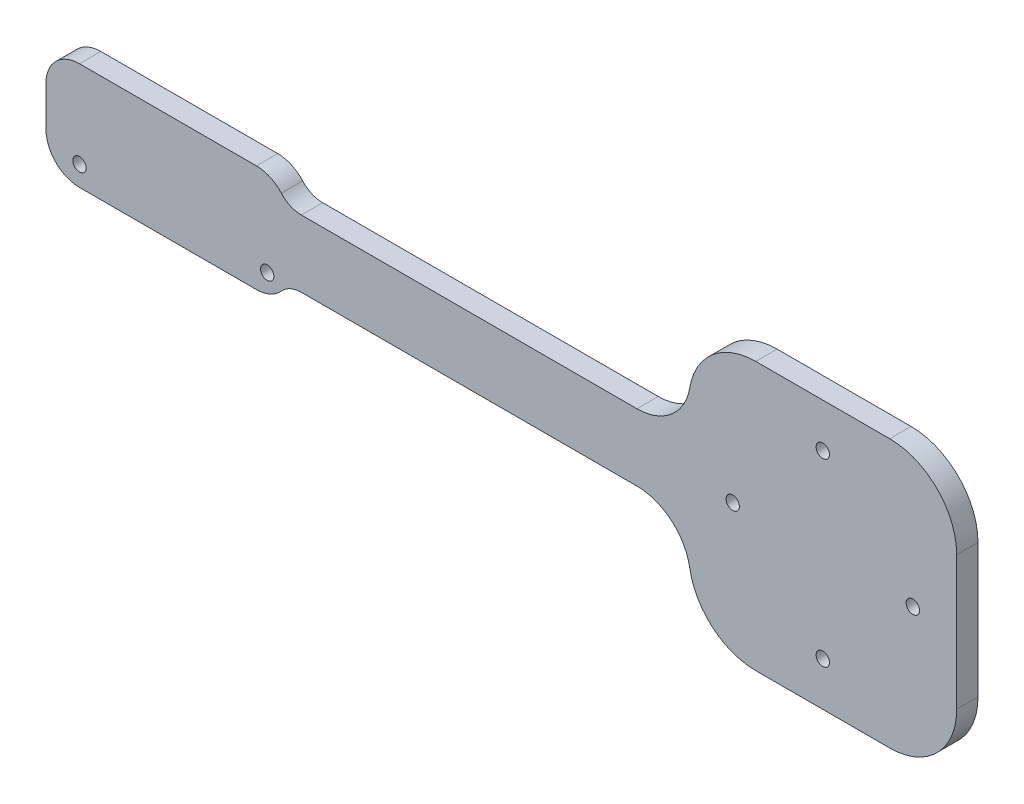
from build123d import *

# Parameters (mm, degrees)
SKETCH1_W           = 40
SKETCH1_H           = 40
BOSS_EXTRUDE1_DEPTH = 3.18
SKETCH2_W           = 3.18
SKETCH2_H           = 10
BOSS_EXTRUDE2_DEPTH = 60
SKETCH3_W           = 3.18
SKETCH3_H           = 16
BOSS_EXTRUDE3_DEPTH = 36
FILLET1_R           = 10
FILLET2_R           = 8
FILLET3_R           = 5
FILLET4_R           = 4
SKETCH7_R           = 1
CUT_EXTRUDE2_DEPTH  = 3.18
SKETCH8_R           = 1
CUT_EXTRUDE3_DEPTH  = 3.18


with BuildPart() as part:
    # Sketch1 → Boss-Extrude1 (new body)
    with BuildSketch(Plane.XY):
        with Locations((50, 0)):
            Rectangle(SKETCH1_W, SKETCH1_H)
    extrude(amount=BOSS_EXTRUDE1_DEPTH)

    # Sketch2 → Boss-Extrude2 (add)
    with BuildSketch(Plane.ZY.offset(-30)):
        with Locations((1.59, 0)):
            Rectangle(SKETCH2_W, SKETCH2_H)
    extrude(amount=BOSS_EXTRUDE2_DEPTH)

    # Sketch3 → Boss-Extrude3 (add)
    with BuildSketch(Plane.ZY.offset(30)):
        with Locations((1.59, 0)):
            Rectangle(SKETCH3_W, SKETCH3_H)
    extrude(amount=BOSS_EXTRUDE3_DEPTH)

    # Fillet1
    fillet1_edges = [part.edges().sort_by_distance(p)[0] for p in [
        (70, -20, 1.59),
        (30, -20, 1.59),
        (30, 20, 1.59),
        (70, 20, 1.59),
    ]]
    fillet(fillet1_edges, radius=FILLET1_R)

    # Fillet2
    fillet2_edges = [part.edges().sort_by_distance(p)[0] for p in [
        (30, 5, 1.59),
        (30, -5, 1.59),
    ]]
    fillet(fillet2_edges, radius=FILLET2_R)

    # Fillet3
    # the kernel refuses this fillet: 5 mm, written as the material it takes off along each edge
    with BuildSketch(Plane(origin=(-30, 8, -11.456439237), x_dir=(-1, 0, 0), z_dir=(0, 0, 1))) as fillet3_piece_1:
        with BuildLine():
            CenterArc((4.582575695, 5), FILLET3_R, 203.578178478, 66.421821522)
            Line((0, 3), (-0.091651514, 2.96))
            ThreePointArc((-0.091651514, 2.96), (-0.1, 1.5), (-0.1, 0))
            Line((-0.1, 0), (0, -0.1))
            Line((0, -0.1), (4.582575695, -0.1))
            Line((4.582575695, -0.1), (4.582575695, 0))
        make_face()
    extrude(amount=26.092878475, mode=Mode.SUBTRACT)
    with BuildSketch(Plane(origin=(-66, 8, -12.5), x_dir=(0, -1, 0), z_dir=(0, 0, 1))) as fillet3_piece_2:
        with BuildLine():
            CenterArc((FILLET3_R, FILLET3_R), FILLET3_R, 180, 90)
            Line((0, FILLET3_R), (-FILLET3_R * 0.02, FILLET3_R))
            Line((-FILLET3_R * 0.02, FILLET3_R), (-FILLET3_R * 0.02, -FILLET3_R * 0.02))
            Line((-FILLET3_R * 0.02, -FILLET3_R * 0.02), (FILLET3_R, -FILLET3_R * 0.02))
            Line((FILLET3_R, -FILLET3_R * 0.02), (FILLET3_R, 0))
        make_face()
    extrude(amount=28.18, mode=Mode.SUBTRACT)
    with BuildSketch(Plane(origin=(-66, -8, 15.68), x_dir=(1, 0, 0), z_dir=(0, 0, -1))) as fillet3_piece_3:
        with BuildLine():
            CenterArc((FILLET3_R, -FILLET3_R), FILLET3_R, 90, 90)
            Line((0, -FILLET3_R), (-FILLET3_R * 0.02, -FILLET3_R))
            Line((-FILLET3_R * 0.02, -FILLET3_R), (-FILLET3_R * 0.02, FILLET3_R * 0.02))
            Line((-FILLET3_R * 0.02, FILLET3_R * 0.02), (FILLET3_R, FILLET3_R * 0.02))
            Line((FILLET3_R, FILLET3_R * 0.02), (FILLET3_R, 0))
        make_face()
    extrude(amount=28.18, mode=Mode.SUBTRACT)
    with BuildSketch(Plane(origin=(-30, -8, 14.636439237), x_dir=(0, 1, 0), z_dir=(0, 0, -1))) as fillet3_piece_4:
        with BuildLine():
            CenterArc((5, -4.582575695), FILLET3_R, 113.578178478, 66.421821522)
            Line((0, -4.582575695), (-0.1, -4.582575695))
            Line((-0.1, -4.582575695), (-0.1, 0))
            Line((-0.1, 0), (0, 0.1))
            ThreePointArc((0, 0.1), (1.5, 0.1), (2.96, 0.091651514))
            Line((2.96, 0.091651514), (3, 0))
        make_face()
    extrude(amount=26.092878475, mode=Mode.SUBTRACT)

    # Fillet4
    fillet4_edges = [part.edges().sort_by_distance(p)[0] for p in [
        (-30, -5, 1.59),
        (-30, 5, 1.59),
    ]]
    fillet(fillet4_edges, radius=FILLET4_R)

    # Sketch7 → Cut-Extrude2 (cut)
    with BuildSketch(Plane.XY.offset(3.18)):
        with Locations((63.45, 0)):
            Circle(SKETCH7_R)
        with Locations((36.55, 0)):
            Circle(SKETCH7_R)
        with Locations((50, 13.45)):
            Circle(SKETCH7_R)
        with Locations((50, -13.45)):
            Circle(SKETCH7_R)
    extrude(amount=-CUT_EXTRUDE2_DEPTH, mode=Mode.SUBTRACT)

    # Sketch8 → Cut-Extrude3 (cut)
    with BuildSketch(Plane.XY.offset(3.18)):
        with Locations((-32.97, -5)):
            Circle(SKETCH8_R)
        with Locations((-61, -5)):
            Circle(SKETCH8_R)
    extrude(amount=-CUT_EXTRUDE3_DEPTH, mode=Mode.SUBTRACT)


solid = part.part
